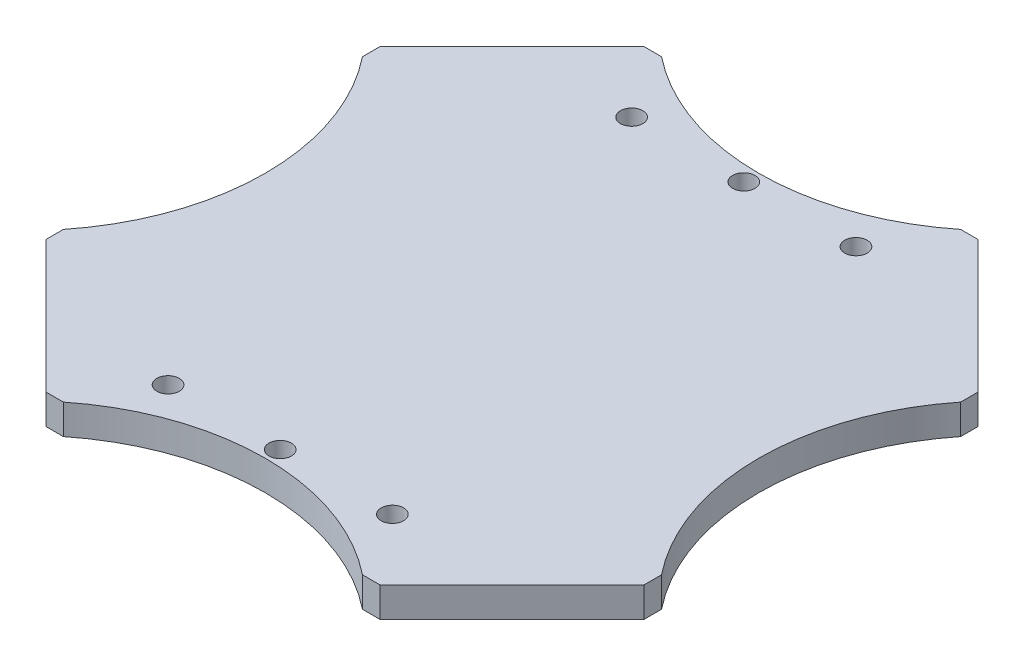
from build123d import *

# Parameters (mm, degrees)
BOSS_EXTRUDE1_DEPTH = 4
CUT_EXTRUDE1_DEPTH  = 57.709787515
SKETCH5_R           = 1.5
CUT_EXTRUDE2_DEPTH  = 57.709787515


with BuildPart() as part:
    # Sketch1 → Boss-Extrude1 (new body)
    with BuildSketch(Plane(origin=(0, 0, 0), x_dir=(1, 0, 0), z_dir=(0, 1, 0))):
        Polygon((22.32233047, 40), (-22.32233047, 40), (-40, 22.32233047), (-40, -22.32233047), (-22.32233047, -40), (22.32233047, -40), (40, -22.32233047), (40, 22.32233047), align=None)
    extrude(amount=BOSS_EXTRUDE1_DEPTH)

    # Sketch2 → Cut-Extrude1 (cut, through all)
    with BuildSketch(Plane(origin=(0, 4, 0), x_dir=(1, 0, 0), z_dir=(0, 1, 0))):
        with BuildLine():
            Line((-40, 20), (-40, -20))
            ThreePointArc((-40, -20), (-33, 0), (-40, 20))
        make_face()
        with BuildLine():
            Line((20, 40), (-20, 40))
            ThreePointArc((-20, 40), (0, 33), (20, 40))
        make_face()
        with BuildLine():
            Line((40, -20), (40, 20))
            ThreePointArc((40, 20), (33, 0), (40, -20))
        make_face()
        with BuildLine():
            Line((-20, -40), (20, -40))
            ThreePointArc((20, -40), (0, -33), (-20, -40))
        make_face()
    extrude(amount=-CUT_EXTRUDE1_DEPTH, mode=Mode.SUBTRACT)

    # Sketch5 → Cut-Extrude2 (cut, through all)
    with BuildSketch(Plane.XZ):
        with Locations((-15, 31)):
            Circle(SKETCH5_R)
        with Locations((0, 31)):
            Circle(SKETCH5_R)
        with Locations((15, 31)):
            Circle(SKETCH5_R)
        with Locations((15, -31)):
            Circle(SKETCH5_R)
        with Locations((0, -31)):
            Circle(SKETCH5_R)
        with Locations((-15, -31)):
            Circle(SKETCH5_R)
    extrude(amount=-CUT_EXTRUDE2_DEPTH, mode=Mode.SUBTRACT)


solid = part.part
